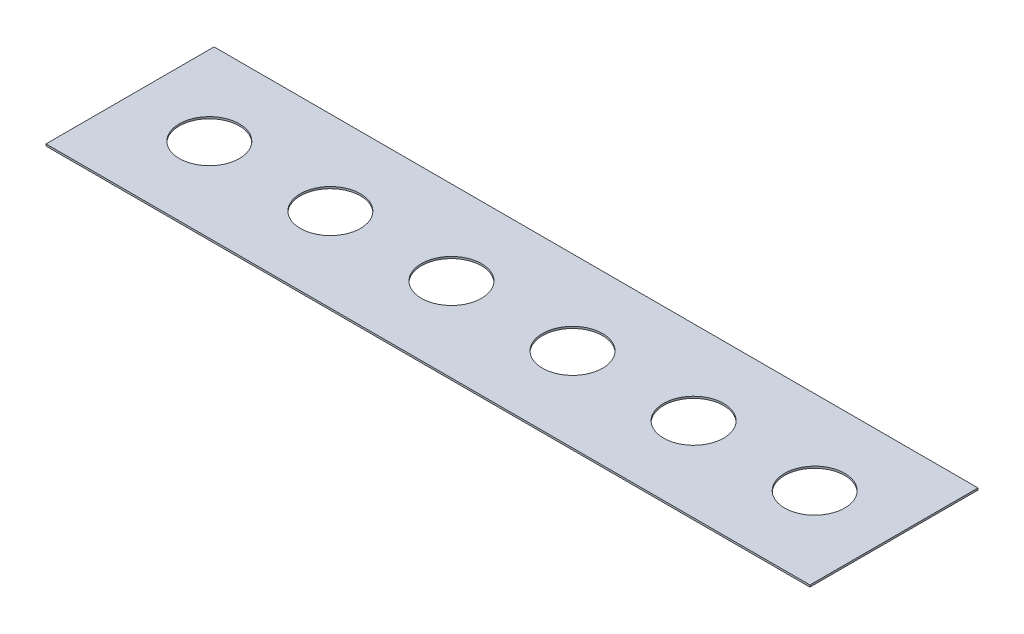
from build123d import *

# Parameters (mm, degrees)
SKETCH1_W           = 635
SKETCH1_H           = 139.7
SKETCH1_R           = 24.9936
BOSS_EXTRUDE1_DEPTH = 1.5748


with BuildPart() as part:
    # Sketch1 → Boss-Extrude1 (new body)
    with BuildSketch(Plane(origin=(0, 0, 0), x_dir=(1, 0, 0), z_dir=(0, 1, 0))):
        Rectangle(SKETCH1_W, SKETCH1_H)
        with Locations((-251.587, 0)):
            Circle(SKETCH1_R, mode=Mode.SUBTRACT)
        with Locations((-150.9522, 0)):
            Circle(SKETCH1_R, mode=Mode.SUBTRACT)
        with Locations((-50.3174, 0)):
            Circle(SKETCH1_R, mode=Mode.SUBTRACT)
        with Locations((50.3174, 0)):
            Circle(SKETCH1_R, mode=Mode.SUBTRACT)
        with Locations((150.9522, 0)):
            Circle(SKETCH1_R, mode=Mode.SUBTRACT)
        with Locations((251.587, 0)):
            Circle(SKETCH1_R, mode=Mode.SUBTRACT)
    extrude(amount=BOSS_EXTRUDE1_DEPTH)


solid = part.part
